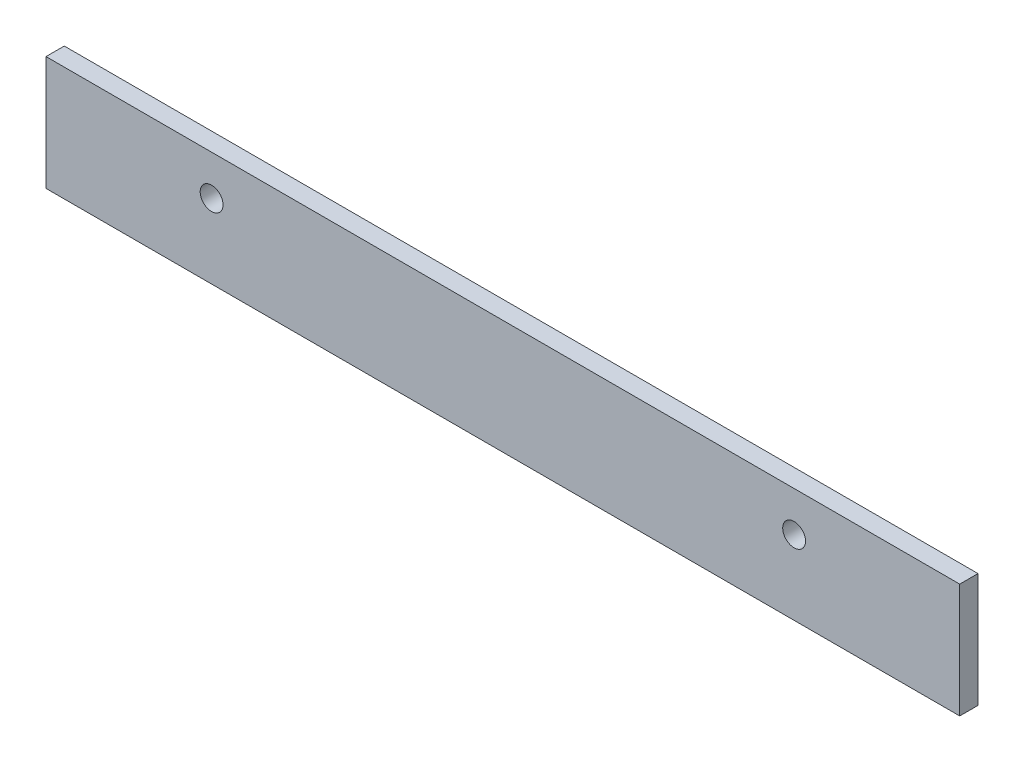
from build123d import *

# Parameters (mm, degrees)
SKETCH2_W               = 160
SKETCH2_H               = 20
BOSS_EXTRUDE1_DEPTH     = 3.2
CUT_EXTRUDE1_DEPTH      = 162.276904732
CUT_EXTRUDE1_DEPTH_BACK = 162.276904732
SKETCH5_R               = 2


with BuildPart() as part:
    # Sketch2 → Boss-Extrude1 (new body)
    with BuildSketch(Plane(origin=(0, -10, 10), x_dir=(1, 0, 0), z_dir=(0, 0, -1))):
        with Locations((80, 0)):
            Rectangle(SKETCH2_W, SKETCH2_H)
    extrude(amount=BOSS_EXTRUDE1_DEPTH)

    # Sketch5 → Cut-Extrude1 (cut, two sides: drawn at the far end of the back side and taken through both)
    with BuildSketch(Plane.XY.offset(10).offset(-CUT_EXTRUDE1_DEPTH_BACK)):
        with Locations((131, -7)):
            Circle(SKETCH5_R)
        with Locations((29, -7)):
            Circle(SKETCH5_R)
    extrude(amount=CUT_EXTRUDE1_DEPTH + CUT_EXTRUDE1_DEPTH_BACK, mode=Mode.SUBTRACT)


solid = part.part
